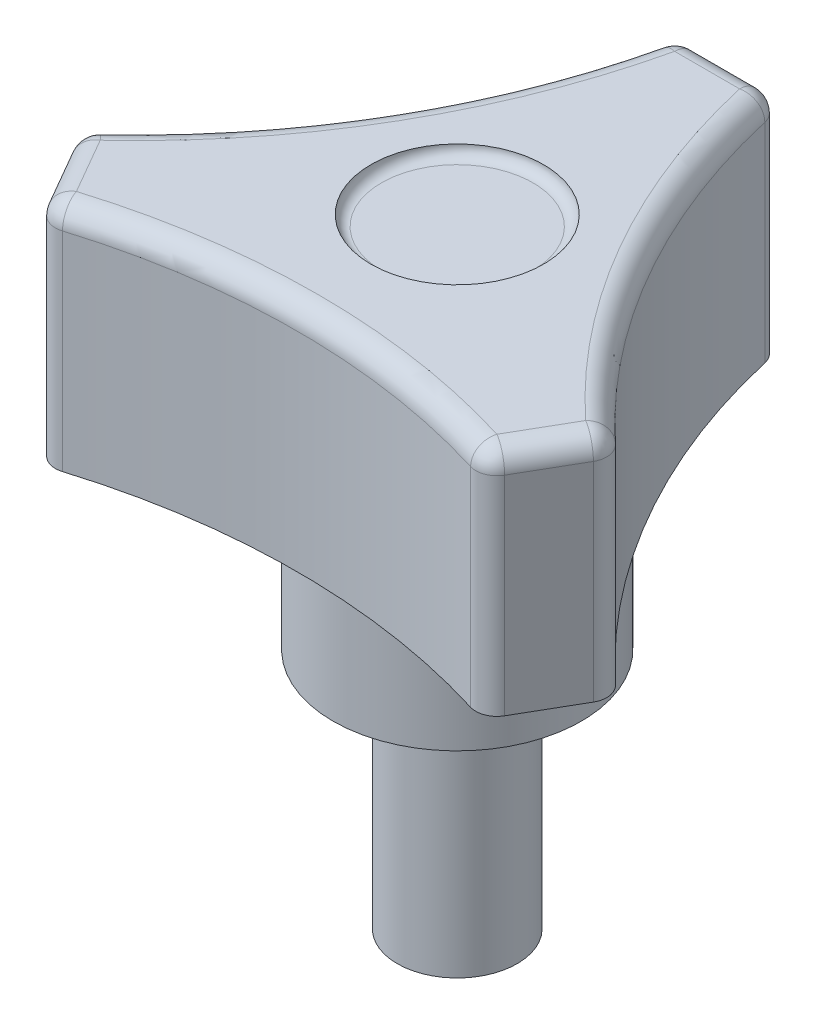
from build123d import *

# Parameters (mm, degrees)
SKETCH1_R           = 2.85
BOSS_EXTRUDE1_DEPTH = 11.5
SKETCH2_R           = 5.9
BOSS_EXTRUDE2_DEPTH = 7
BOSS_EXTRUDE3_DEPTH = 10.9
FILLET1_R           = 1
SKETCH4_R           = 4.1
CUT_EXTRUDE1_DEPTH  = 0.5
FILLET2_R           = 0.5


with BuildPart() as part:
    # Sketch1 → Boss-Extrude1 (new body)
    with BuildSketch(Plane(origin=(0, 0, 0), x_dir=(1, 0, 0), z_dir=(0, 1, 0))):
        with Locations(Location((0, 0, 0), (0, 0, 270))):
            Circle(SKETCH1_R)
    extrude(amount=BOSS_EXTRUDE1_DEPTH)


with BuildPart() as body_2:
    # Sketch2 → Boss-Extrude2 (new body)
    with BuildSketch(Plane(origin=(0, 11.5, 0), x_dir=(1, 0, 0), z_dir=(0, 1, 0))):
        with Locations(Location((0, 0, 0), (0, 0, 270))):
            Circle(SKETCH2_R)
    extrude(amount=BOSS_EXTRUDE2_DEPTH)

    # Sketch3 → Boss-Extrude3 (add)
    with BuildSketch(Plane(origin=(0, 18.5, 0), x_dir=(1, 0, 0), z_dir=(0, 1, 0))):
        with BuildLine():
            Line((10.45, -9.3), (12.8, -5.229680602))
            ThreePointArc((12.8, -5.229680602), (6.102756814, 2.970284867), (2.35, 12.870250337))
            Line((2.35, 12.870250337), (-2.35, 12.870250337))
            ThreePointArc((-2.35, 12.870250337), (-6.102756814, 2.970284867), (-12.8, -5.229680602))
            Line((-12.8, -5.229680602), (-10.45, -9.3))
            ThreePointArc((-10.45, -9.3), (0, -7.6), (10.45, -9.3))
        make_face()
    extrude(amount=BOSS_EXTRUDE3_DEPTH)

    # Fillet1
    fillet1_edges = [body_2.edges().sort_by_distance(p)[0] for p in [
        (-11.625, 29.4, 7.264840301),
        (-10.45, 23.95, 9.3),
        (10.45, 23.95, 9.3),
        (12.8, 23.95, 5.229680602),
        (2.35, 23.95, -12.870250337),
        (-2.35, 23.95, -12.870250337),
        (-12.8, 23.95, 5.229680602),
        (0, 29.4, 7.6),
        (11.625, 29.4, 7.264840301),
        (6.102756814, 29.4, -2.970284867),
        (0, 29.4, -12.870250337),
        (-6.102756814, 29.4, -2.970284867),
    ]]
    fillet(fillet1_edges, radius=FILLET1_R)

    # Sketch4 → Cut-Extrude1 (cut)
    with BuildSketch(Plane(origin=(0, 29.4, 0), x_dir=(1, 0, 0), z_dir=(0, 1, 0))):
        with Locations(Location((0, 0, 0), (0, 0, 270))):
            Circle(SKETCH4_R)
    extrude(amount=-CUT_EXTRUDE1_DEPTH, mode=Mode.SUBTRACT)

    # Fillet2
    fillet2_edges = [body_2.edges().sort_by_distance(p)[0] for p in [
        (0, 28.9, -4.1),
    ]]
    fillet(fillet2_edges, radius=FILLET2_R - 0.0001)  # a hair under: the kernel refuses the full size


solid = Compound([part.part, body_2.part])
